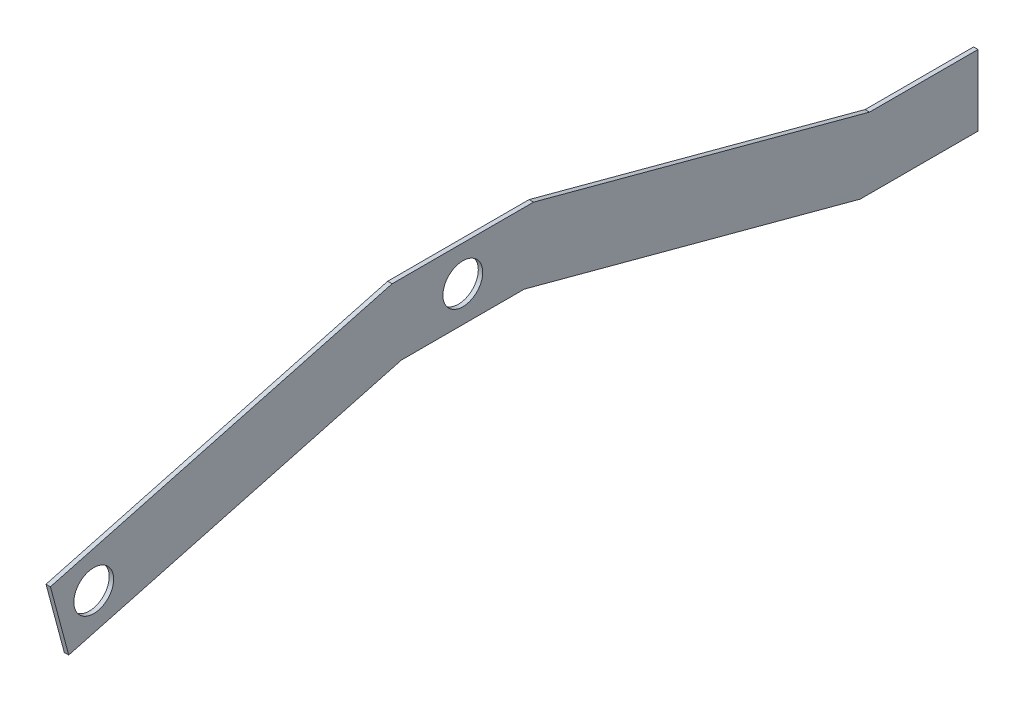
from build123d import *

# Parameters (mm, degrees)
SKETCH1_R           = 14.2875
BOSS_EXTRUDE1_DEPTH = 3.175
SKETCH3_R           = 12.7
CUT_EXTRUDE2_DEPTH  = 501.923776165
SKETCH5_W           = 50.8
SKETCH5_H           = 247.65
CUT_EXTRUDE4_DEPTH  = 501.923776165
SKETCH6_W           = 127
SKETCH6_H           = 25.4
CUT_EXTRUDE5_DEPTH  = 384.019234201
BOSS_EXTRUDE2_DEPTH = 3.175


with BuildPart() as part:
    # Sketch1 → Boss-Extrude1 (new body)
    with BuildSketch(Plane(origin=(0, 0, 0), x_dir=(0, 0, -1), z_dir=(1, 0, 0))):
        Polygon((-50.8, 25.4), (50.8, 25.4), (369.963359856, -60.119564527), (369.963359856, -337.700549698), (319.163359856, -337.700549698), (319.163359856, -99.099775516), (44.112053123, -25.4), (-44.112053123, -25.4), (-282.997152386, -89.409069432), (-296.145159877, -40.340037456), align=None)
        with Locations((-265.036640144, -58.300549698)):
            Circle(SKETCH1_R, mode=Mode.SUBTRACT)
        Circle(SKETCH1_R, mode=Mode.SUBTRACT)
    extrude(amount=BOSS_EXTRUDE1_DEPTH)

    # Sketch3 → Cut-Extrude2 (cut, through all)
    with BuildSketch(Plane(origin=(3.175, 0, 0), x_dir=(0, 0, -1), z_dir=(1, 0, 0))):
        with Locations((344.563359856, -312.300549698)):
            Circle(SKETCH3_R)
    extrude(amount=-CUT_EXTRUDE2_DEPTH, mode=Mode.SUBTRACT)

    # Sketch5 → Cut-Extrude4 (cut, through all)
    with BuildSketch(Plane(origin=(3.175, 0, 0), x_dir=(0, 0, -1), z_dir=(1, 0, 0))):
        with Locations((344.563359856, -213.875549698)):
            Rectangle(SKETCH5_W, SKETCH5_H)
    extrude(amount=-CUT_EXTRUDE4_DEPTH, mode=Mode.SUBTRACT)

    # Sketch6 → Cut-Extrude5 (cut, through all)
    with BuildSketch(Plane(origin=(3.175, 0, 0), x_dir=(0, 0, -1), z_dir=(1, 0, 0))):
        with Locations((306.463359856, -102.750549698)):
            Rectangle(SKETCH6_W, SKETCH6_H)
    extrude(amount=-CUT_EXTRUDE5_DEPTH, mode=Mode.SUBTRACT)

    # Sketch7 → Boss-Extrude2 (add)
    with BuildSketch(Plane(origin=(3.175, 0, 0), x_dir=(0, 0, -1), z_dir=(1, 0, 0))):
        Polygon((292.079136211, -39.250549698), (369.963359856, -39.250549698), (369.963359856, -60.119564527), align=None)
    extrude(amount=-BOSS_EXTRUDE2_DEPTH)


solid = part.part
